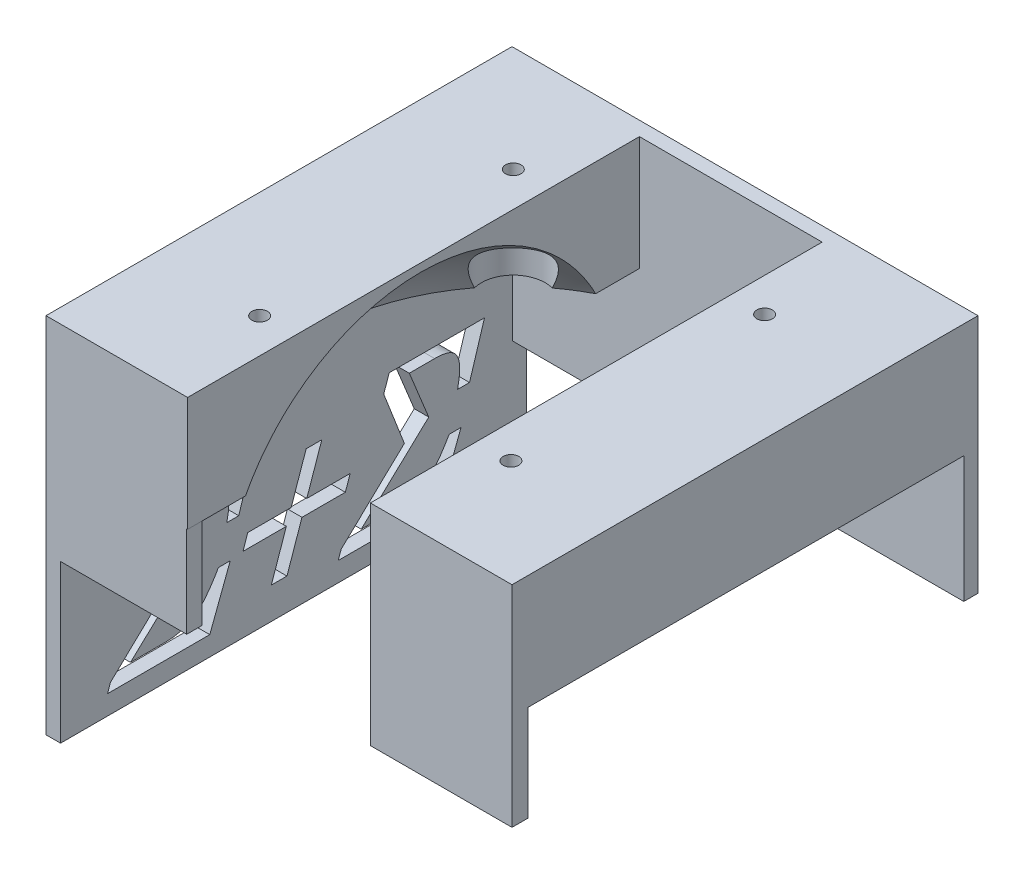
from build123d import *
from build123d.topology import SkipClean

# Parameters (mm, degrees)
SKETCH1_W                   = 102
SKETCH1_H                   = 102
BOSS_EXTRUDE1_DEPTH         = 50
CUT_EXTRUDE_THIN1_OUTLINE_W = 40
CUT_EXTRUDE_THIN1_OUTLINE_H = 95.773670058
CUT_EXTRUDE_THIN1_DEPTH     = 50
SKETCH4_W                   = 40
SKETCH4_H                   = 6.202657501
CUT_EXTRUDE3_DEPTH          = 54
SKETCH5_W                   = 33.817621941
SKETCH5_H                   = 102.594578927
CUT_EXTRUDE4_DEPTH          = 20
SKETCH6_W                   = 27.820383201
SKETCH6_H                   = 98.886835029
CUT_EXTRUDE5_DEPTH          = 20
SKETCH7_W                   = 30.8
SKETCH7_H                   = 3.364819678
BOSS_EXTRUDE2_DEPTH         = 21
SKETCH9_W                   = 31
SKETCH9_H                   = 3.479961613
BOSS_EXTRUDE4_DEPTH         = 21
SKETCH11_W                  = 98.820383201
SKETCH11_H                  = 3.113164971
BOSS_EXTRUDE6_DEPTH         = 47.625
SKETCH14_W                  = 102
SKETCH14_H                  = 5
CUT_EXTRUDE7_DEPTH          = 105
SKETCH17_R                  = 7
CUT_EXTRUDE12_DEPTH         = 20.5
M3_CLEARANCE_HOLE1_D        = 3.4
SKETCH22_W                  = 3.179616799
SKETCH22_H                  = 102
BOSS_EXTRUDE7_DEPTH         = 47.6
SKETCH23_W                  = 98.820383201
SKETCH23_H                  = 3.113164971
CUT_EXTRUDE13_DEPTH         = 40
SKETCH24_W                  = 102
SKETCH24_H                  = 13.144479163
CUT_EXTRUDE14_DEPTH         = 40


# Read off the part's stored shape, not the designer's step: Cut-Extrude-Thin1
with BuildPart() as part:
    # Sketch1 → Boss-Extrude1 (new body)
    with BuildSketch(Plane(origin=(0, 0, 0), x_dir=(1, 0, 0), z_dir=(0, 1, 0))):
        with Locations((-66.567363259, 25.977216604)):
            Rectangle(SKETCH1_W, SKETCH1_H)
    extrude(amount=BOSS_EXTRUDE1_DEPTH)

    # Sketch2 → Cut-Revolve1 (revolve, cut)
    with SkipClean():  # the faces are left unmerged after this step: merging them gives an invalid solid
        with BuildSketch(Plane(origin=(0, 0, 0), x_dir=(1, 0, 0), z_dir=(0, 1, 0))):
            with BuildLine():
                ThreePointArc((-66.567363259, 73.602216604), (-114.192363259, 25.977216604), (-66.567363259, -21.647783396))
                Line((-66.567363259, -21.647783396), (-66.567363259, 73.602216604))
            make_face()
            with BuildLine():
                Line((-66.567363259, 73.602216604), (-66.567363259, -21.647783396))
                ThreePointArc((-66.567363259, -21.647783396), (-32.891402805, -7.69874385), (-18.942363259, 25.977216604))
                ThreePointArc((-18.942363259, 25.977216604), (-32.891402805, 59.653177058), (-66.567363259, 73.602216604))
            make_face()
        revolve(axis=Axis((-66.567363259, 0, 21.647783396), (0, 0, -1)), mode=Mode.SUBTRACT)
    add(part.part.scale(1), mode=Mode.REPLACE)  # the faces are merged on a copy

    # Cut-Extrude-Thin1 outline → Cut-Extrude-Thin1 (cut)
    with BuildSketch(Plane(origin=(0, 0, 0), x_dir=(1, 0, 0), z_dir=(0, 1, 0))):
        with Locations((-66.567363259, 25.977216604)):
            Rectangle(CUT_EXTRUDE_THIN1_OUTLINE_W, CUT_EXTRUDE_THIN1_OUTLINE_H)
    extrude(amount=CUT_EXTRUDE_THIN1_DEPTH, mode=Mode.SUBTRACT)

    # Sketch4 → Cut-Extrude3 (cut)
    with BuildSketch(Plane(origin=(0, 0, 0), x_dir=(1, 0, 0), z_dir=(0, 1, 0))):
        with Locations((-66.567363259, -25.010947176)):
            Rectangle(SKETCH4_W, SKETCH4_H)
    extrude(amount=CUT_EXTRUDE3_DEPTH, mode=Mode.SUBTRACT)

    # Sketch5 → Cut-Extrude4 (cut)
    with BuildSketch(Plane(origin=(0, 0, 0), x_dir=(1, 0, 0), z_dir=(0, 1, 0))):
        with Locations((-29.658552289, 22.56676217)):
            Rectangle(SKETCH5_W, SKETCH5_H)
    extrude(amount=CUT_EXTRUDE4_DEPTH, mode=Mode.SUBTRACT)

    # Sketch6 → Cut-Extrude5 (cut)
    with BuildSketch(Plane(origin=(0, 0, 0), x_dir=(-1, 0, 0), z_dir=(0, -1, 0))):
        with Locations((100.47755486, 24.420634119)):
            Rectangle(SKETCH6_W, SKETCH6_H)
    extrude(amount=-CUT_EXTRUDE5_DEPTH, mode=Mode.SUBTRACT)

    # Sketch7 → Boss-Extrude2 (add)
    with BuildSketch(Plane(origin=(0, 0, 0), x_dir=(1, 0, 0), z_dir=(0, 1, 0))):
        with Locations((-102.167363259, -23.340373557)):
            Rectangle(SKETCH7_W, SKETCH7_H)
    extrude(amount=BOSS_EXTRUDE2_DEPTH)

    # Sketch9 → Boss-Extrude4 (add)
    with BuildSketch(Plane.XZ.offset(-20)):
        with Locations((-31.067363259, 23.28280259)):
            Rectangle(SKETCH9_W, SKETCH9_H)
    extrude(amount=BOSS_EXTRUDE4_DEPTH)

    # Sketch11 → Boss-Extrude6 (add)
    with BuildSketch(Plane.XZ):
        with Locations((-64.97755486, -75.420634119)):
            Rectangle(SKETCH11_W, SKETCH11_H)
    extrude(amount=BOSS_EXTRUDE6_DEPTH)

    # Sketch14 → Cut-Extrude7 (cut)
    with BuildSketch(Plane(origin=(-15.567363259, 0, 0), x_dir=(0, 0, -1), z_dir=(1, 0, 0))):
        with Locations((25.977216604, 47.5)):
            Rectangle(SKETCH14_W, SKETCH14_H)
    extrude(amount=-CUT_EXTRUDE7_DEPTH, mode=Mode.SUBTRACT)

    # Sketch17 → Cut-Extrude12 (cut)
    with BuildSketch(Plane.XZ.offset(-20)):
        with Locations(Location((-94.167363259, 1.657963718, 0), (0, 0, 270))):
            Circle(SKETCH17_R)
        with Locations(Location((-94.167363259, -53.864051633, 0), (0, 0, 284.685382437))):
            Circle(SKETCH17_R)
        with Locations(Location((-39.167363259, 1.657963718, 0), (0, 0, 349.246729183))):
            Circle(SKETCH17_R)
        with Locations(Location((-39.167363259, -53.864051633, 0), (0, 0, 270))):
            Circle(SKETCH17_R)
    extrude(amount=-CUT_EXTRUDE12_DEPTH, mode=Mode.SUBTRACT)

    # M3 Clearance Hole1 (through all)
    with Locations(Plane(origin=(0, 40.5, 0), x_dir=(-1, 0, 0), z_dir=(0, -1, 0))):
        with Locations((94.167363259, -1.657963718), (39.167363259, -1.657963718), (39.167363259, 53.864051633), (94.167363259, 53.864051633)):
            Hole(M3_CLEARANCE_HOLE1_D / 2)

    # Sketch22 → Boss-Extrude7 (add)
    with BuildSketch(Plane.XZ):
        with Locations((-115.97755486, -25.977216604)):
            Rectangle(SKETCH22_W, SKETCH22_H)
    extrude(amount=BOSS_EXTRUDE7_DEPTH)

    # Sketch23 → Cut-Extrude13 (cut)
    with BuildSketch(Plane.XZ.offset(47.625)):
        with Locations((-64.97755486, -75.420634119)):
            Rectangle(SKETCH23_W, SKETCH23_H)
    extrude(amount=-CUT_EXTRUDE13_DEPTH, mode=Mode.SUBTRACT)

    # Sketch24 → Cut-Extrude14 (cut)
    with BuildSketch(Plane(origin=(-114.38774646, 0, 0), x_dir=(0, 0, -1), z_dir=(1, 0, 0))):
        with Locations((25.977216604, -41.027760419)):
            Rectangle(SKETCH24_W, SKETCH24_H)
        with BuildLine():
            Line((5.071568807, -12.935354721), (-9.70295651, -26.79018067))
            Line((-9.70295651, -26.79018067), (-2.054617902, -26.79018067))
            add(Edge.make_bspline(
                [(-2.054617902, -26.79018067), (-1.765726012, -26.785652216), (-1.198903029, -26.776767121), (-0.362043292, -26.705784215), (0.441463952, -26.578761536), (1.218387397, -26.416539594), (1.960870944, -26.194132068), (2.67406934, -25.929541459), (3.354206774, -25.609948444), (4.020487515, -25.247757111), (4.676120511, -24.7900176), (5.331851529, -24.221869382), (6.004386082, -23.541546075), (6.683129442, -22.740988818), (7.38353451, -21.833166923), (8.094337294, -20.806957687), (8.825811496, -19.668777644), (9.295647528, -18.857081479), (9.539527667, -18.435750291)],
                knots=[0, 0, 0, 0, 0.913221668, 1.791794948, 2.652225869, 3.483703697, 4.298798693, 5.100131842, 5.886195413, 6.672656764, 7.494795965, 8.408317253, 9.411951548, 10.516043997, 11.72415507, 13.03547234, 14.461187798, 16, 16, 16, 16], degree=3))
            Line((9.539527667, -18.435750291), (12.126552984, -18.435750291))
            Line((12.126552984, -18.435750291), (7.646727035, -30.207902189))
            Line((7.646727035, -30.207902189), (-14.734602079, -30.207902189))
            Line((-14.734602079, -30.207902189), (-14.105646383, -28.398171177))
            Line((-14.105646383, -28.398171177), (-0.268621067, -15.249436999))
            Line((-0.268621067, -15.249436999), (-4.784048282, -3.661224974))
            Line((-4.784048282, -3.661224974), (-3.585472333, -0.207902189))
            Line((-3.585472333, -0.207902189), (17.27686944, -0.207902189))
            Line((17.27686944, -0.207902189), (13.99561944, -10.840813582))
            Line((13.99561944, -10.840813582), (11.384859946, -10.840813582))
            add(Edge.make_bspline(
                [(11.384859946, -10.840813582), (11.442080865, -10.548422745), (11.552388469, -9.984766425), (11.681747944, -9.167319709), (11.780796247, -8.409964668), (11.835471962, -7.710825578), (11.847831557, -7.068859405), (11.825395451, -6.486233937), (11.770659959, -5.961261838), (11.638696255, -5.35902847), (11.396530776, -4.703671408), (11.018857365, -4.016991367), (10.502164674, -3.487889343), (9.887153763, -3.091686133), (9.16452487, -2.814843897), (8.335292078, -2.626405953), (7.389025886, -2.507570942), (6.719504544, -2.493717022), (6.365081465, -2.486383202)],
                knots=[0, 0, 0, 0, 1.186105462, 2.286514331, 3.294486224, 4.226380739, 5.076976882, 5.849324364, 6.546743712, 7.175376687, 8.298899997, 9.318614935, 10.270913514, 11.210098922, 12.210289516, 13.335274437, 14.589379933, 16, 16, 16, 16], degree=3))
            Line((6.365081465, -2.486383202), (0.811283997, -2.486383202))
            Line((0.811283997, -2.486383202), (5.071568807, -12.935354721))
        make_face()
        Polygon((15.965556148, -15.018028772), (25.459227035, -15.018028772), (28.746410579, -5.524357886), (32.164132098, -5.524357886), (28.876948554, -15.018028772), (38.37061944, -15.018028772), (37.320382098, -18.056003455), (27.826711212, -18.056003455), (24.539527667, -27.549674341), (21.121806148, -27.549674341), (24.408989693, -18.056003455), (14.915318807, -18.056003455), align=None)
        with BuildLine():
            Line((55.577897921, -12.935354721), (40.803372604, -26.79018067))
            Line((40.803372604, -26.79018067), (48.451711212, -26.79018067))
            add(Edge.make_bspline(
                [(48.451711212, -26.79018067), (48.740603102, -26.785652216), (49.307426085, -26.776767121), (50.144285822, -26.705784215), (50.947793065, -26.578761536), (51.724716511, -26.416539594), (52.467200057, -26.194132068), (53.180398454, -25.929541459), (53.860535888, -25.609948444), (54.526816629, -25.247757111), (55.182449625, -24.7900176), (55.838180643, -24.221869382), (56.510715196, -23.541546075), (57.189458556, -22.740988818), (57.889863624, -21.833166923), (58.600666408, -20.806957687), (59.33214061, -19.668777644), (59.801976642, -18.857081479), (60.045856781, -18.435750291)],
                knots=[0, 0, 0, 0, 0.913221668, 1.791794948, 2.652225869, 3.483703697, 4.298798693, 5.100131842, 5.886195413, 6.672656764, 7.494795965, 8.408317253, 9.411951548, 10.516043997, 11.72415507, 13.03547234, 14.461187798, 16, 16, 16, 16], degree=3))
            Line((60.045856781, -18.435750291), (62.632882098, -18.435750291))
            Line((62.632882098, -18.435750291), (58.153056148, -30.207902189))
            Line((58.153056148, -30.207902189), (35.771727035, -30.207902189))
            Line((35.771727035, -30.207902189), (36.400682731, -28.398171177))
            Line((36.400682731, -28.398171177), (50.237708047, -15.249436999))
            Line((50.237708047, -15.249436999), (45.722280832, -3.661224974))
            Line((45.722280832, -3.661224974), (46.920856781, -0.207902189))
            Line((46.920856781, -0.207902189), (67.783198554, -0.207902189))
            Line((67.783198554, -0.207902189), (64.501948554, -10.840813582))
            Line((64.501948554, -10.840813582), (61.89118906, -10.840813582))
            add(Edge.make_bspline(
                [(61.89118906, -10.840813582), (61.948409979, -10.548422745), (62.058717583, -9.984766425), (62.188077058, -9.167319709), (62.287125361, -8.409964668), (62.341801076, -7.710825578), (62.354160671, -7.068859405), (62.331724565, -6.486233937), (62.276989073, -5.961261838), (62.145025369, -5.35902847), (61.90285989, -4.703671408), (61.525186479, -4.016991367), (61.008493788, -3.487889343), (60.393482877, -3.091686133), (59.670853984, -2.814843897), (58.841621192, -2.626405953), (57.895354999, -2.507570942), (57.225833658, -2.493717022), (56.871410579, -2.486383202)],
                knots=[0, 0, 0, 0, 1.186105462, 2.286514331, 3.294486224, 4.226380739, 5.076976882, 5.849324364, 6.546743712, 7.175376687, 8.298899997, 9.318614935, 10.270913514, 11.210098922, 12.210289516, 13.335274437, 14.589379933, 16, 16, 16, 16], degree=3))
            Line((56.871410579, -2.486383202), (51.317613111, -2.486383202))
            Line((51.317613111, -2.486383202), (55.577897921, -12.935354721))
        make_face()
    extrude(amount=-CUT_EXTRUDE14_DEPTH, mode=Mode.SUBTRACT)


solid = part.part
